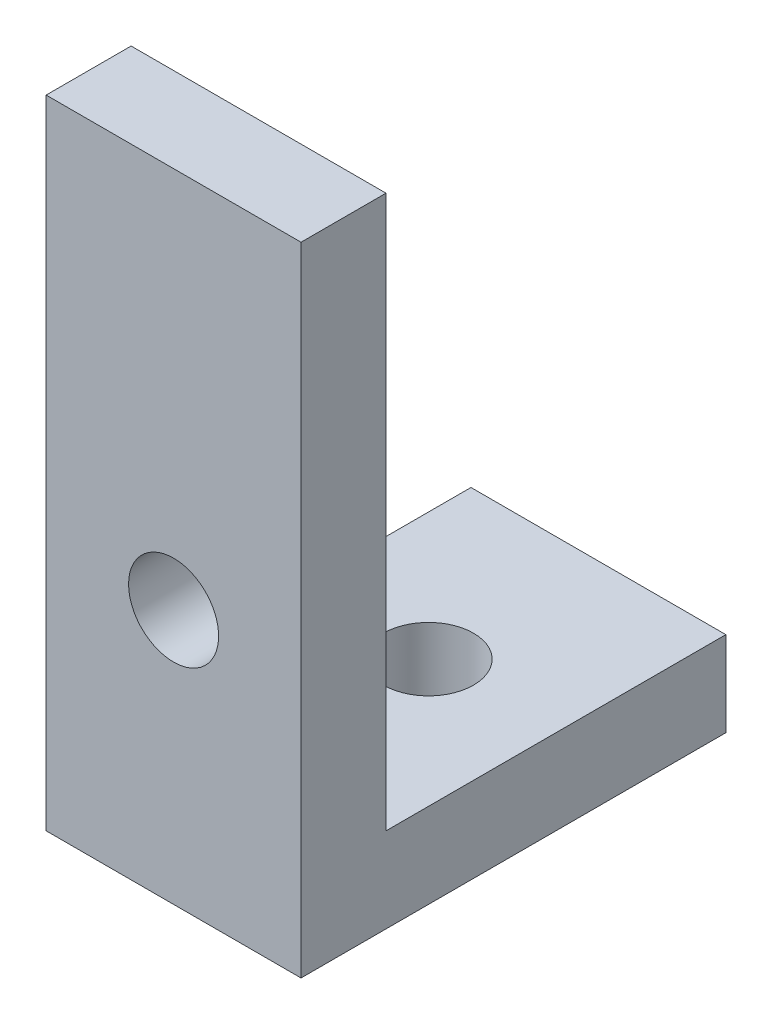
from build123d import *

# Parameters (mm, degrees)
SKETCH2_W           = 15
SKETCH2_H           = 37.5
BOSS_EXTRUDE1_DEPTH = 5
SKETCH3_W           = 15
SKETCH3_H           = 5
BOSS_EXTRUDE2_DEPTH = 20
SKETCH6_R           = 2.65
CUT_EXTRUDE2_DEPTH  = 10
SKETCH7_R           = 2.65
CUT_EXTRUDE3_DEPTH  = 10


with BuildPart() as part:
    # Sketch2 → Boss-Extrude1 (new body)
    with BuildSketch(Plane.XY):
        with Locations((7.5, 18.75)):
            Rectangle(SKETCH2_W, SKETCH2_H)
    extrude(amount=BOSS_EXTRUDE1_DEPTH)

    # Sketch3 → Boss-Extrude2 (add)
    with BuildSketch(Plane.XY):
        with Locations((7.5, 2.5)):
            Rectangle(SKETCH3_W, SKETCH3_H)
    extrude(amount=-BOSS_EXTRUDE2_DEPTH)

    # Sketch6 → Cut-Extrude2 (cut)
    with BuildSketch(Plane.XZ):
        with Locations((7.5, -10)):
            Circle(SKETCH6_R)
    extrude(amount=-CUT_EXTRUDE2_DEPTH, mode=Mode.SUBTRACT)

    # Sketch7 → Cut-Extrude3 (cut)
    with BuildSketch(Plane(origin=(0, 0, 0), x_dir=(-1, 0, 0), z_dir=(0, 0, -1))):
        with Locations((-7.5, 15)):
            Circle(SKETCH7_R)
    extrude(amount=-CUT_EXTRUDE3_DEPTH, mode=Mode.SUBTRACT)


solid = part.part
